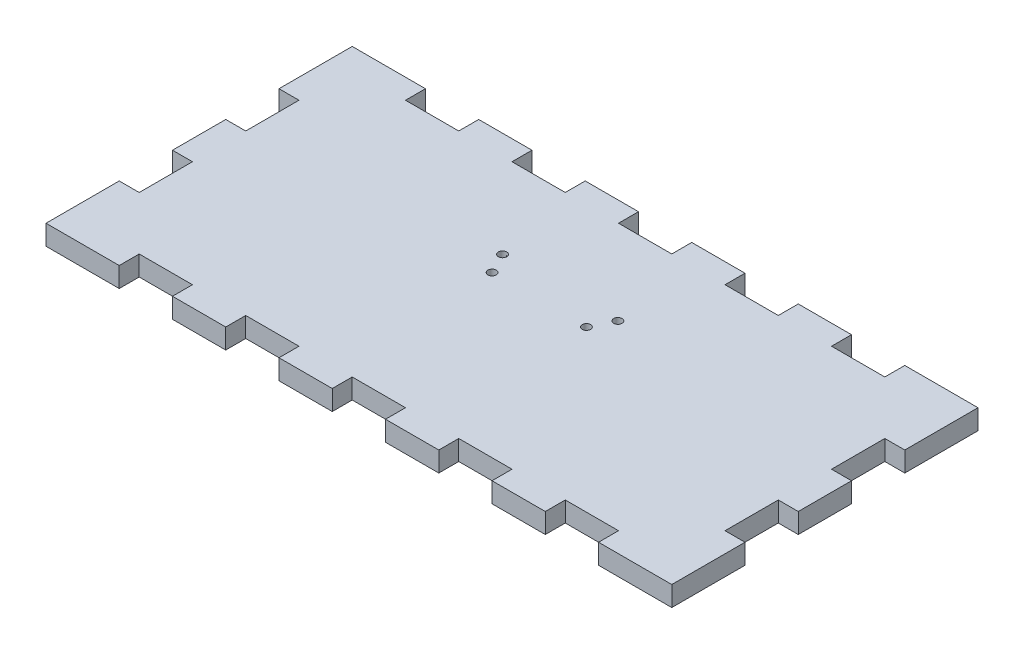
from build123d import *

# Parameters (mm, degrees)
SKETCH2_W               = 279.4
SKETCH2_H               = 127
BOSS_EXTRUDE1_DEPTH     = 9.525
SKETCH3_W               = 25.4
SKETCH3_H               = 9.525
BOSS_EXTRUDE2_DEPTH     = 9.525
LPATTERN1_COUNT         = 6
LPATTERN1_PITCH         = 50.8
MIRROR1_COPY_1_SKETCH_W = 25.4
MIRROR1_COPY_1_SKETCH_H = 9.525
MIRROR1_COPY_1_DEPTH    = 9.525
MIRROR1_COPY_2_SKETCH_W = 25.4
MIRROR1_COPY_2_SKETCH_H = 9.525
MIRROR1_COPY_2_DEPTH    = 9.525
MIRROR1_COPY_3_SKETCH_W = 25.4
MIRROR1_COPY_3_SKETCH_H = 9.525
MIRROR1_COPY_3_DEPTH    = 9.525
MIRROR1_COPY_4_SKETCH_W = 25.4
MIRROR1_COPY_4_SKETCH_H = 9.525
MIRROR1_COPY_4_DEPTH    = 9.525
MIRROR1_COPY_5_SKETCH_W = 25.4
MIRROR1_COPY_5_SKETCH_H = 9.525
MIRROR1_COPY_5_DEPTH    = 9.525
MIRROR1_COPY_6_SKETCH_W = 25.4
MIRROR1_COPY_6_SKETCH_H = 9.525
MIRROR1_COPY_6_DEPTH    = 9.525
SKETCH4_W               = 25.4
SKETCH4_H               = 9.525
BOSS_EXTRUDE3_DEPTH     = 9.525
LPATTERN2_COUNT         = 3
LPATTERN2_PITCH         = 50.8
MIRROR2_COPY_1_SKETCH_W = 25.4
MIRROR2_COPY_1_SKETCH_H = 9.525
MIRROR2_COPY_1_DEPTH    = 9.525
MIRROR2_COPY_2_SKETCH_W = 25.4
MIRROR2_COPY_2_SKETCH_H = 9.525
MIRROR2_COPY_2_DEPTH    = 9.525
MIRROR2_COPY_3_SKETCH_W = 25.4
MIRROR2_COPY_3_SKETCH_H = 9.525
MIRROR2_COPY_3_DEPTH    = 9.525
SKETCH6_W               = 9.525
SKETCH6_H               = 9.525
BOSS_EXTRUDE4_DEPTH     = 9.525
MIRROR4_COPY_1_SKETCH_W = 9.525
MIRROR4_COPY_1_SKETCH_H = 9.525
MIRROR4_COPY_1_DEPTH    = 9.525
MIRROR4_COPY_2_SKETCH_W = 9.525
MIRROR4_COPY_2_SKETCH_H = 9.525
MIRROR4_COPY_2_DEPTH    = 9.525
SKETCH7_R               = 0.03199703
SKETCH7_R_2             = 0.105640644
SKETCH7_R_3             = 2
CUT_EXTRUDE1_DEPTH      = 167.407562554
SKETCH8_R               = 2
SKETCH8_R_2             = 0.050904791
CUT_EXTRUDE3_DEPTH      = 167.407562554
SKETCH9_R               = 3.81
CUT_EXTRUDE4_DEPTH      = 4.7625


with BuildPart() as part:
    # Sketch2 → Boss-Extrude1 (new body)
    with BuildSketch(Plane(origin=(0, 0, 0), x_dir=(1, 0, 0), z_dir=(0, 1, 0))):
        Rectangle(SKETCH2_W, SKETCH2_H)
    extrude(amount=BOSS_EXTRUDE1_DEPTH)

    # Sketch3 → Boss-Extrude2 (add)
    with BuildSketch(Plane.XY.offset(63.5)):
        with Locations((-127, 4.7625)):
            Rectangle(SKETCH3_W, SKETCH3_H)
    boss_extrude2 = extrude(amount=BOSS_EXTRUDE2_DEPTH)

    # LPattern1: Boss-Extrude2 ×6
    with Locations(*[(i * LPATTERN1_PITCH, 0, 0) for i in range(1, LPATTERN1_COUNT)]):
        add(boss_extrude2)

    # Mirror1 copy 1 sketch → Mirror1 copy 1 (add)
    with BuildSketch(Plane(origin=(50.8, 0, -63.5), x_dir=(1, 0, 0), z_dir=(0, 0, -1))):
        with Locations((-127, -4.7625)):
            Rectangle(MIRROR1_COPY_1_SKETCH_W, MIRROR1_COPY_1_SKETCH_H)
    extrude(amount=MIRROR1_COPY_1_DEPTH)

    # Mirror1 copy 2 sketch → Mirror1 copy 2 (add)
    with BuildSketch(Plane(origin=(101.6, 0, -63.5), x_dir=(1, 0, 0), z_dir=(0, 0, -1))):
        with Locations((-127, -4.7625)):
            Rectangle(MIRROR1_COPY_2_SKETCH_W, MIRROR1_COPY_2_SKETCH_H)
    extrude(amount=MIRROR1_COPY_2_DEPTH)

    # Mirror1 copy 3 sketch → Mirror1 copy 3 (add)
    with BuildSketch(Plane(origin=(152.4, 0, -63.5), x_dir=(1, 0, 0), z_dir=(0, 0, -1))):
        with Locations((-127, -4.7625)):
            Rectangle(MIRROR1_COPY_3_SKETCH_W, MIRROR1_COPY_3_SKETCH_H)
    extrude(amount=MIRROR1_COPY_3_DEPTH)

    # Mirror1 copy 4 sketch → Mirror1 copy 4 (add)
    with BuildSketch(Plane(origin=(203.2, 0, -63.5), x_dir=(1, 0, 0), z_dir=(0, 0, -1))):
        with Locations((-127, -4.7625)):
            Rectangle(MIRROR1_COPY_4_SKETCH_W, MIRROR1_COPY_4_SKETCH_H)
    extrude(amount=MIRROR1_COPY_4_DEPTH)

    # Mirror1 copy 5 sketch → Mirror1 copy 5 (add)
    with BuildSketch(Plane(origin=(254, 0, -63.5), x_dir=(1, 0, 0), z_dir=(0, 0, -1))):
        with Locations((-127, -4.7625)):
            Rectangle(MIRROR1_COPY_5_SKETCH_W, MIRROR1_COPY_5_SKETCH_H)
    extrude(amount=MIRROR1_COPY_5_DEPTH)

    # Mirror1 copy 6 sketch → Mirror1 copy 6 (add)
    with BuildSketch(Plane(origin=(0, 0, -63.5), x_dir=(1, 0, 0), z_dir=(0, 0, -1))):
        with Locations((-127, -4.7625)):
            Rectangle(MIRROR1_COPY_6_SKETCH_W, MIRROR1_COPY_6_SKETCH_H)
    extrude(amount=MIRROR1_COPY_6_DEPTH)

    # Sketch4 → Boss-Extrude3 (add)
    with BuildSketch(Plane(origin=(139.7, 0, 0), x_dir=(0, 0, -1), z_dir=(1, 0, 0))):
        with Locations((-50.8, 4.7625)):
            Rectangle(SKETCH4_W, SKETCH4_H)
    boss_extrude3 = extrude(amount=BOSS_EXTRUDE3_DEPTH)

    # LPattern2: Boss-Extrude3 ×3
    with Locations(*[(0, 0, -i * LPATTERN2_PITCH) for i in range(1, LPATTERN2_COUNT)]):
        add(boss_extrude3)

    # Mirror2 copy 1 sketch → Mirror2 copy 1 (add)
    with BuildSketch(Plane(origin=(-139.7, 0, -50.8), x_dir=(0, 0, -1), z_dir=(-1, 0, 0))):
        with Locations((-50.8, -4.7625)):
            Rectangle(MIRROR2_COPY_1_SKETCH_W, MIRROR2_COPY_1_SKETCH_H)
    extrude(amount=MIRROR2_COPY_1_DEPTH)

    # Mirror2 copy 2 sketch → Mirror2 copy 2 (add)
    with BuildSketch(Plane(origin=(-139.7, 0, -101.6), x_dir=(0, 0, -1), z_dir=(-1, 0, 0))):
        with Locations((-50.8, -4.7625)):
            Rectangle(MIRROR2_COPY_2_SKETCH_W, MIRROR2_COPY_2_SKETCH_H)
    extrude(amount=MIRROR2_COPY_2_DEPTH)

    # Mirror2 copy 3 sketch → Mirror2 copy 3 (add)
    with BuildSketch(Plane(origin=(-139.7, 0, 0), x_dir=(0, 0, -1), z_dir=(-1, 0, 0))):
        with Locations((-50.8, -4.7625)):
            Rectangle(MIRROR2_COPY_3_SKETCH_W, MIRROR2_COPY_3_SKETCH_H)
    extrude(amount=MIRROR2_COPY_3_DEPTH)

    # Sketch6 → Boss-Extrude4 (add)
    with BuildSketch(Plane.XY.offset(63.5)):
        with Locations((144.4625, 4.7625)):
            Rectangle(SKETCH6_W, SKETCH6_H)
    boss_extrude4 = extrude(amount=BOSS_EXTRUDE4_DEPTH)

    # Mirror3: Boss-Extrude4 across plane
    add(boss_extrude4.mirror(Plane(origin=(0, 0, 0), x_dir=(0, 0, 1), z_dir=(1, 0, 0))))

    # Mirror4 copy 1 sketch → Mirror4 copy 1 (add)
    with BuildSketch(Plane(origin=(0, 0, -63.5), x_dir=(-1, 0, 0), z_dir=(0, 0, -1))):
        with Locations((144.4625, 4.7625)):
            Rectangle(MIRROR4_COPY_1_SKETCH_W, MIRROR4_COPY_1_SKETCH_H)
    extrude(amount=MIRROR4_COPY_1_DEPTH)

    # Mirror4 copy 2 sketch → Mirror4 copy 2 (add)
    with BuildSketch(Plane(origin=(0, 0, -63.5), x_dir=(1, 0, 0), z_dir=(0, 0, -1))):
        with Locations((144.4625, -4.7625)):
            Rectangle(MIRROR4_COPY_2_SKETCH_W, MIRROR4_COPY_2_SKETCH_H)
    extrude(amount=MIRROR4_COPY_2_DEPTH)

    # Sketch7 → Cut-Extrude1 (cut, through all)
    with BuildSketch(Plane(origin=(0, 9.525, 0), x_dir=(1, 0, 0), z_dir=(0, 1, 0))):
        with Locations((-29.286448531, 23.811896768)):
            Circle(SKETCH7_R)
        with Locations((-23.072042617, 14.792208322)):
            Circle(SKETCH7_R_2)
        with Locations((27.5, 22.986283459)):
            Circle(SKETCH7_R_3)
        with Locations((22.5, 12.986283459)):
            Circle(SKETCH7_R_3)
    extrude(amount=-CUT_EXTRUDE1_DEPTH, mode=Mode.SUBTRACT)

    # Sketch8 → Cut-Extrude3 (cut, through all)
    # profile 1 of 2: a face of its own
    with BuildSketch(Plane(origin=(0, 9.525, 0), x_dir=(1, 0, 0), z_dir=(0, 1, 0))):
        with Locations((-22.5, 12.986283459)):
            Circle(SKETCH8_R)
    # profile 2 of 2: a face of its own
    with BuildSketch(Plane(origin=(0, 9.525, 0), x_dir=(1, 0, 0), z_dir=(0, 1, 0))):
        with Locations((-27.5, 22.986283459)):
            Circle(SKETCH8_R)
        with Locations((-25.973991065, 23.403291617)):
            Circle(SKETCH8_R_2, mode=Mode.SUBTRACT)
    extrude(amount=-CUT_EXTRUDE3_DEPTH, mode=Mode.SUBTRACT)


with BuildPart() as cut_extrude3_piece_1:
    # of the separate pieces the step leaves, piece 1, a body of its own (cut_extrude3_pieces)
    add(part.part.solids().sort_by_distance((114.3, 0, 63.5))[0])


with BuildPart() as cut_extrude3_piece_2:
    # of the separate pieces the step leaves, piece 2, a body of its own (cut_extrude3_pieces)
    add(part.part.solids().sort_by_distance((-25.923086274, 0, -23.403291617))[0])


with BuildPart() as cut_extrude4_tool:
    # Sketch9 → Cut-Extrude4 (new body)
    with BuildSketch(Plane.XZ):
        with Locations((-22.5, -12.986283459)):
            Circle(SKETCH9_R)
        with Locations((-27.5, -22.986283459)):
            Circle(SKETCH9_R)
        with Locations((22.5, -12.986283459)):
            Circle(SKETCH9_R)
        with Locations((27.5, -22.986283459)):
            Circle(SKETCH9_R)
    extrude(amount=-CUT_EXTRUDE4_DEPTH)


with BuildPart() as cut_extrude3_piece_1_1:
    add(cut_extrude3_piece_1.part)

    # Cut-Extrude4: cut by cut_extrude4_tool
    add(cut_extrude4_tool.part, mode=Mode.SUBTRACT)


with BuildPart() as cut_extrude3_piece_2_1:
    add(cut_extrude3_piece_2.part)

    # Cut-Extrude4: cut by cut_extrude4_tool
    add(cut_extrude4_tool.part, mode=Mode.SUBTRACT)


solid = Compound([cut_extrude3_piece_1_1.part, cut_extrude3_piece_2_1.part])
